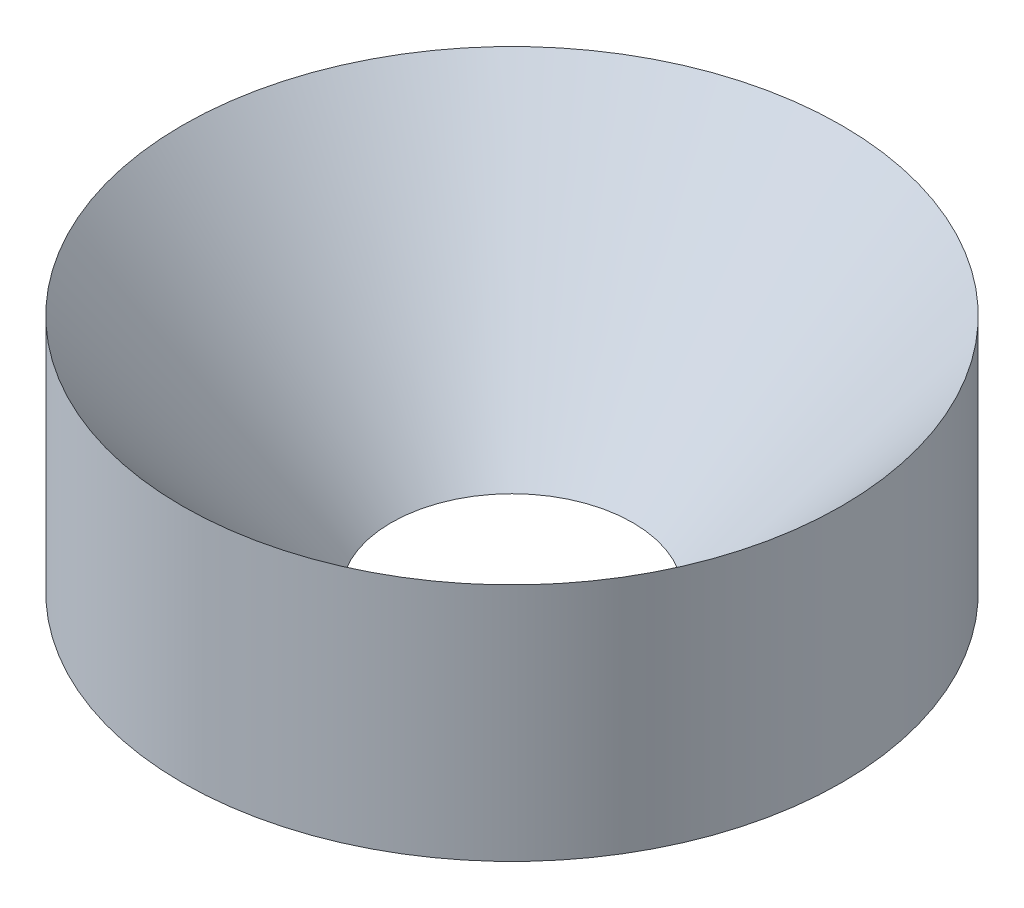
from build123d import *


with BuildPart() as part:
    # Schizzo1 → Rivoluzione1 (revolve)
    with BuildSketch(Plane.XY):
        Polygon((-71, 51.584468491), (-71, 0), (-26, 0), align=None)
    revolve(axis=Axis((0, 0, 0), (0, 1, 0)))


solid = part.part
